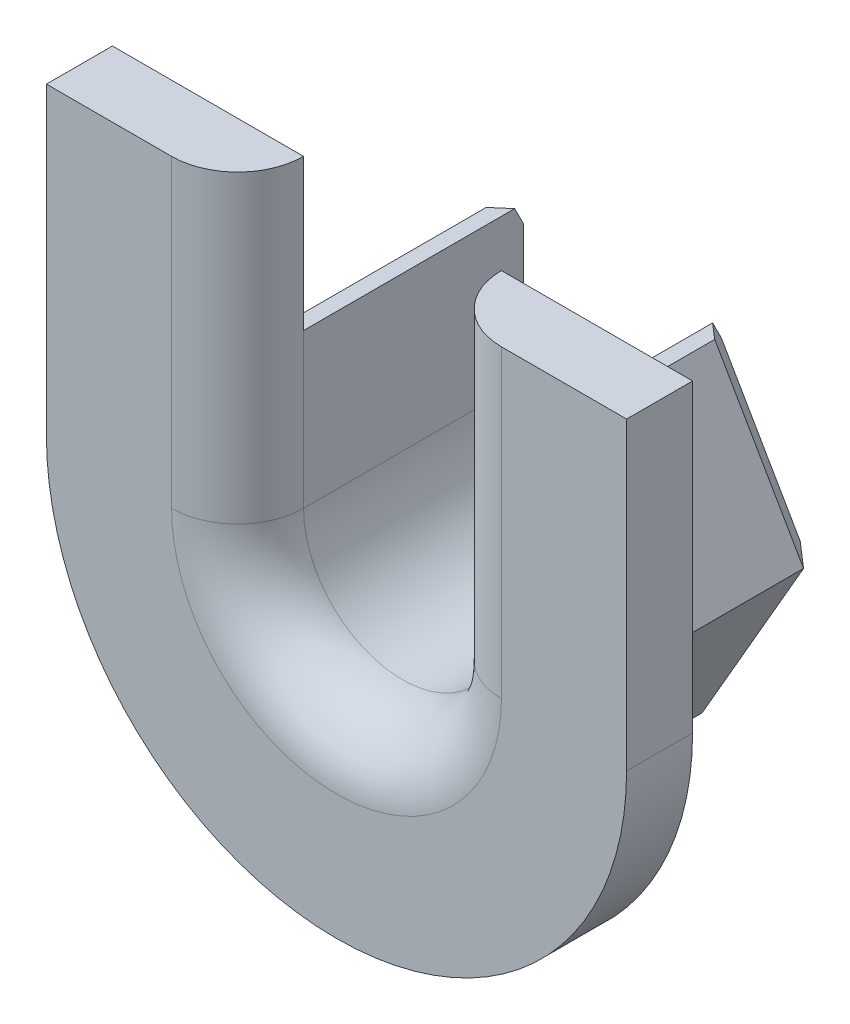
from build123d import *

# Parameters (mm, degrees)
BOSS_EXTRUDE1_DEPTH = 5
BOSS_EXTRUDE2_START = 1.5
BOSS_EXTRUDE2_DEPTH = 1.5
FILLET1_R           = 1.5
CHAMFER1_SIZE       = 0.5


with BuildPart() as part:
    # Sketch1 → Boss-Extrude1 (new body)
    with BuildSketch(Plane.XY):
        with BuildLine():
            Line((9.73, -20.68), (9.73, -24.18))
            ThreePointArc((9.73, -24.18), (7.48, -26.43), (5.23, -24.18))
            Line((5.23, -24.18), (5.23, -20.68))
            Line((5.23, -20.68), (4.881923789, -20.68))
            Line((4.881923789, -20.68), (2.861197846, -24.18))
            Line((2.861197846, -24.18), (5.170598923, -28.18))
            Line((5.170598923, -28.18), (9.789401077, -28.18))
            Line((9.789401077, -28.18), (12.098802154, -24.18))
            Line((12.098802154, -24.18), (10.078076211, -20.68))
            Line((10.078076211, -20.68), (9.73, -20.68))
        make_face()
    extrude(amount=-BOSS_EXTRUDE1_DEPTH)

    # Sketch2 → Boss-Extrude2 (add)
    with BuildSketch(Plane.XY.offset(BOSS_EXTRUDE2_START)):
        with BuildLine():
            Line((0.885, -17.25), (0.885, -19.25))
            Line((0.885, -19.25), (0.885, -24.18))
            ThreePointArc((0.885, -24.18), (7.48, -30.775), (14.075, -24.18))
            Line((14.075, -24.18), (14.075, -17.25))
            Line((14.075, -17.25), (10.575, -17.25))
            Line((10.575, -17.25), (9.73, -17.25))
            Line((9.73, -17.25), (9.73, -20.68))
            Line((9.73, -20.68), (9.73, -24.18))
            ThreePointArc((9.73, -24.18), (7.48, -26.43), (5.23, -24.18))
            Line((5.23, -24.18), (5.23, -20.68))
            Line((5.23, -20.68), (5.23, -17.25))
            Line((5.23, -17.25), (0.885, -17.25))
        make_face()
    extrude(amount=-BOSS_EXTRUDE2_DEPTH)

    # Fillet1
    fillet1_edges = [part.edges().sort_by_distance(p)[0] for p in [
        (9.73, -20.715, 1.5),
        (5.23, -20.715, 1.5),
        (7.48, -26.43, 1.5),
    ]]
    fillet(fillet1_edges, radius=FILLET1_R)

    # Chamfer1
    chamfer1_edges = [part.edges().sort_by_distance(p)[0] for p in [
        (3.871560818, -22.43, -5),
        (4.015898385, -26.18, -5),
        (7.48, -28.18, -5),
        (10.944101615, -26.18, -5),
        (11.088439182, -22.43, -5),
    ]]
    chamfer(chamfer1_edges, length=CHAMFER1_SIZE)


solid = part.part
